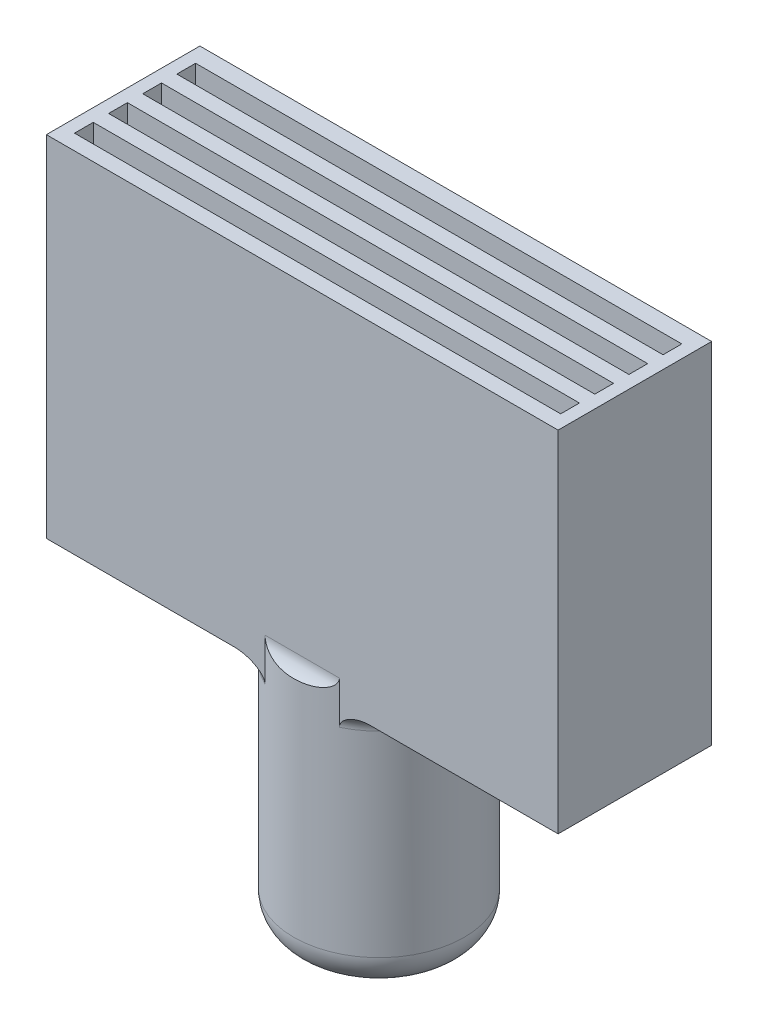
from build123d import *

# Parameters (mm, degrees)
SKETCH1_R           = 10
BOSS_EXTRUDE1_DEPTH = 30
FILLET1_R           = 4
SKETCH2_W           = 60
SKETCH2_H           = 18
SKETCH2_W_2         = 57
SKETCH2_H_2         = 2.2
BOSS_EXTRUDE2_DEPTH = 40
SKETCH3_W           = 60
SKETCH3_H           = 18
BOSS_EXTRUDE3_DEPTH = 1
FILLET2_R           = 2
FILLET3_R           = 2


with BuildPart() as part:
    # Sketch1 → Boss-Extrude1 (new body)
    with BuildSketch(Plane(origin=(0, 0, 0), x_dir=(1, 0, 0), z_dir=(0, 1, 0))):
        with Locations(Location((0, 0, 0), (0, 0, 270))):
            Circle(SKETCH1_R)
    extrude(amount=BOSS_EXTRUDE1_DEPTH)

    # Fillet1
    fillet1_edges = [part.edges().sort_by_distance(p)[0] for p in [
        (0, 0, -10),
    ]]
    fillet(fillet1_edges, radius=FILLET1_R)

    # Sketch2 → Boss-Extrude2 (add)
    with BuildSketch(Plane(origin=(0, 30, 0), x_dir=(1, 0, 0), z_dir=(0, 1, 0))):
        Rectangle(SKETCH2_W, SKETCH2_H)
        with Locations((0, 1.9)):
            Rectangle(SKETCH2_W_2, SKETCH2_H_2, mode=Mode.SUBTRACT)
        with Locations((0, 5.9)):
            Rectangle(SKETCH2_W_2, SKETCH2_H_2, mode=Mode.SUBTRACT)
        with Locations((0, -2.1)):
            Rectangle(SKETCH2_W_2, SKETCH2_H_2, mode=Mode.SUBTRACT)
        with Locations((0, -6.1)):
            Rectangle(SKETCH2_W_2, SKETCH2_H_2, mode=Mode.SUBTRACT)
    extrude(amount=BOSS_EXTRUDE2_DEPTH)

    # Sketch3 → Boss-Extrude3 (add)
    with BuildSketch(Plane.XZ.offset(-30)):
        Rectangle(SKETCH3_W, SKETCH3_H)
    extrude(amount=BOSS_EXTRUDE3_DEPTH)

    # Fillet2
    fillet2_edges = [part.edges().sort_by_distance(p)[0] for p in [
        (-10, 29, 0),
        (10, 29, 0),
    ]]
    fillet(fillet2_edges, radius=FILLET2_R)

    # Fillet3
    # the kernel refuses this fillet: 2 mm, written as the material it adds along each edge
    with BuildSketch(Plane(origin=(-9.358898944, 30, 9), x_dir=(0, 0, 1), z_dir=(1, 0, 0))) as fillet3_piece_1_section:
        with BuildLine():
            CenterArc((FILLET3_R, -FILLET3_R), FILLET3_R, 90, 90)
            Line((0, -FILLET3_R), (0, 0))
            Line((0, 0), (FILLET3_R, 0))
        make_face()
    fillet3_piece_1 = extrude(amount=18.717797887, mode=Mode.PRIVATE)
    fillet3_piece_1 = fillet3_piece_1 & Plane(origin=(0, 30.566631584, 0), x_dir=(0, 0, 1), z_dir=(0, -1, 0)) * Cylinder(10, 46, mode=Mode.PRIVATE)
    add(fillet3_piece_1)
    with BuildSketch(Plane(origin=(9.358898944, 30, -9), x_dir=(0, 0, -1), z_dir=(-1, 0, 0))) as fillet3_piece_2_section:
        with BuildLine():
            CenterArc((FILLET3_R, -FILLET3_R), FILLET3_R, 90, 90)
            Line((0, -FILLET3_R), (0, 0))
            Line((0, 0), (FILLET3_R, 0))
        make_face()
    fillet3_piece_2 = extrude(amount=18.717797887, mode=Mode.PRIVATE)
    fillet3_piece_2 = fillet3_piece_2 & Plane(origin=(0, 30.566641093, 0), x_dir=(0, 0, 1), z_dir=(0, -1, 0)) * Cylinder(10, 46, mode=Mode.PRIVATE)
    add(fillet3_piece_2)


solid = part.part
